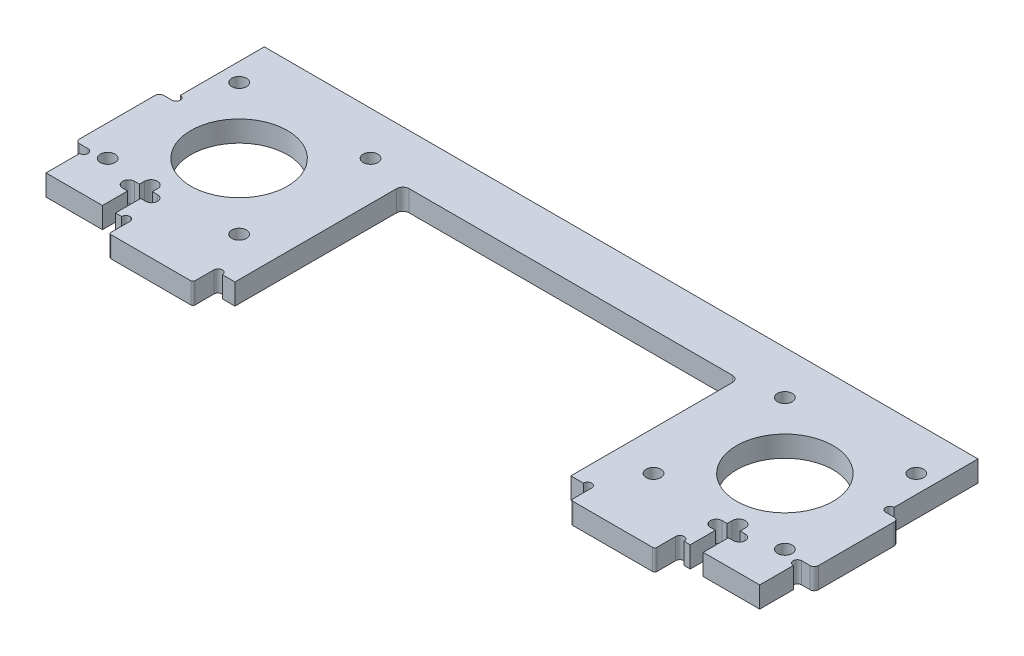
from build123d import *

# Parameters (mm, degrees)
SKETCH_1_W          = 170
SKETCH_1_H          = 52
EXTRUDE_1_DEPTH     = 5
SKETCH_2_R          = 11.5
SKETCH_2_R_2        = 1.75
CUT_EXTRUDE_1_DEPTH = 5
SKETCH_3_W          = 20
SKETCH_3_H          = 5
EXTRUDE_2_DEPTH     = 5
SKETCH_4_R          = 1
CUT_EXTRUDE_2_DEPTH = 5
CUT_EXTRUDE_3_DEPTH = 10
FILLET_1_R          = 0.5
SKETCH_7_W          = 3
SKETCH_7_H          = 20
EXTRUDE_3_DEPTH     = 5
SKETCH_8_R          = 1
CUT_EXTRUDE_5_DEPTH = 5
SKETCH_9_W          = 80
SKETCH_9_H          = 40
CUT_EXTRUDE_6_DEPTH = 10
FILLET_2_R          = 1.5
FILLET_3_R          = 1


with BuildPart() as part:
    # 스케치1 → 보스-돌출1 (new body)
    with BuildSketch(Plane(origin=(0, 0, 0), x_dir=(1, 0, 0), z_dir=(0, 1, 0))):
        with Locations((85, 26)):
            Rectangle(SKETCH_1_W, SKETCH_1_H)
    extrude(amount=EXTRUDE_1_DEPTH)

    # 스케치2 → 컷-돌출1 (cut)
    with BuildSketch(Plane(origin=(0, 5, 0), x_dir=(1, 0, 0), z_dir=(0, 1, 0))):
        with Locations((150, 26)):
            Circle(SKETCH_2_R)
        with Locations((165.65, 41.65)):
            Circle(SKETCH_2_R_2)
        with Locations((134.35, 41.65)):
            Circle(SKETCH_2_R_2)
        with Locations((165.65, 10.35)):
            Circle(SKETCH_2_R_2)
        with Locations((134.35, 10.35)):
            Circle(SKETCH_2_R_2)
        with Locations((35.65, 10.35)):
            Circle(SKETCH_2_R_2)
        with Locations((4.35, 10.35)):
            Circle(SKETCH_2_R_2)
        with Locations((35.65, 41.65)):
            Circle(SKETCH_2_R_2)
        with Locations((4.35, 41.65)):
            Circle(SKETCH_2_R_2)
        with Locations((20, 26)):
            Circle(SKETCH_2_R)
    extrude(amount=-CUT_EXTRUDE_1_DEPTH, mode=Mode.SUBTRACT)

    # 스케치3 → 보스-돌출2 (add)
    with BuildSketch(Plane(origin=(0, 5, 0), x_dir=(1, 0, 0), z_dir=(0, 1, 0))):
        with Locations((140, -2.5)):
            Rectangle(SKETCH_3_W, SKETCH_3_H)
        with Locations((30, -2.5)):
            Rectangle(SKETCH_3_W, SKETCH_3_H)
    extrude(amount=-EXTRUDE_2_DEPTH)

    # 스케치4 → 컷-돌출2 (cut)
    with BuildSketch(Plane(origin=(0, 5, 0), x_dir=(1, 0, 0), z_dir=(0, 1, 0))):
        with Locations((129, 0)):
            Circle(SKETCH_4_R)
        with Locations((151, 0)):
            Circle(SKETCH_4_R)
        with Locations((19, 0)):
            Circle(SKETCH_4_R)
        with Locations((41, 0)):
            Circle(SKETCH_4_R)
    extrude(amount=-CUT_EXTRUDE_2_DEPTH, mode=Mode.SUBTRACT)

    # 스케치5 → 컷-돌출3 (cut)
    with BuildSketch(Plane(origin=(0, 5, 0), x_dir=(1, 0, 0), z_dir=(0, 1, 0))):
        with BuildLine():
            Line((156.55, 0), (156.55, 6))
            Line((156.55, 6), (157.75, 6))
            ThreePointArc((157.75, 6), (159.15, 7.4), (157.75, 8.8))
            Line((157.75, 8.8), (156.55, 8.8))
            Line((156.55, 8.8), (156.55, 10))
            ThreePointArc((156.55, 10), (155, 11.55), (153.45, 10))
            Line((153.45, 10), (153.45, 8.8))
            Line((153.45, 8.8), (152.25, 8.8))
            ThreePointArc((152.25, 8.8), (150.85, 7.4), (152.25, 6))
            Line((152.25, 6), (153.45, 6))
            Line((153.45, 6), (153.45, 0))
            Line((153.45, 0), (156.55, 0))
        make_face()
        with BuildLine():
            Line((12.25, 6), (13.45, 6))
            Line((13.45, 6), (13.45, 0))
            Line((13.45, 0), (16.55, 0))
            Line((16.55, 0), (16.55, 6))
            Line((16.55, 6), (17.75, 6))
            ThreePointArc((17.75, 6), (19.15, 7.4), (17.75, 8.8))
            Line((17.75, 8.8), (16.55, 8.8))
            Line((16.55, 8.8), (16.55, 10))
            ThreePointArc((16.55, 10), (15, 11.55), (13.45, 10))
            Line((13.45, 10), (13.45, 8.8))
            Line((13.45, 8.8), (12.25, 8.8))
            ThreePointArc((12.25, 8.8), (10.85, 7.4), (12.25, 6))
        make_face()
    extrude(amount=-CUT_EXTRUDE_3_DEPTH, mode=Mode.SUBTRACT)

    # 필렛1
    fillet_1_edges = [part.edges().sort_by_distance(p)[0] for p in [
        (20, 2.5, 5),
        (130, 2.5, 5),
        (150, 2.5, 5),
        (40, 2.5, 5),
    ]]
    fillet(fillet_1_edges, radius=FILLET_1_R)

    # 스케치7 → 보스-돌출3 (add)
    with BuildSketch(Plane(origin=(0, 5, 0), x_dir=(1, 0, 0), z_dir=(0, 1, 0))):
        with Locations((171.5, 20)):
            Rectangle(SKETCH_7_W, SKETCH_7_H)
        with Locations((-1.5, 20)):
            Rectangle(SKETCH_7_W, SKETCH_7_H)
    extrude(amount=-EXTRUDE_3_DEPTH)

    # 스케치8 → 컷-돌출5 (cut)
    with BuildSketch(Plane(origin=(0, 5, 0), x_dir=(1, 0, 0), z_dir=(0, 1, 0))):
        with Locations((170, 9)):
            Circle(SKETCH_8_R)
        with Locations((170, 31)):
            Circle(SKETCH_8_R)
        with Locations((0, 9)):
            Circle(SKETCH_8_R)
        with Locations((0, 31)):
            Circle(SKETCH_8_R)
    extrude(amount=-CUT_EXTRUDE_5_DEPTH, mode=Mode.SUBTRACT)

    # 스케치9 → 컷-돌출6 (cut)
    with BuildSketch(Plane(origin=(0, 5, 0), x_dir=(1, 0, 0), z_dir=(0, 1, 0))):
        with Locations((85, 20)):
            Rectangle(SKETCH_9_W, SKETCH_9_H)
    extrude(amount=-CUT_EXTRUDE_6_DEPTH, mode=Mode.SUBTRACT)

    # 필렛2
    fillet_2_edges = [part.edges().sort_by_distance(p)[0] for p in [
        (125, 2.5, -40),
        (45, 2.5, -40),
    ]]
    fillet(fillet_2_edges, radius=FILLET_2_R)

    # 필렛3
    fillet_3_edges = [part.edges().sort_by_distance(p)[0] for p in [
        (173, 2.5, -10),
        (173, 2.5, -30),
        (-3, 2.5, -10),
        (-3, 2.5, -30),
    ]]
    fillet(fillet_3_edges, radius=FILLET_3_R)


solid = part.part
